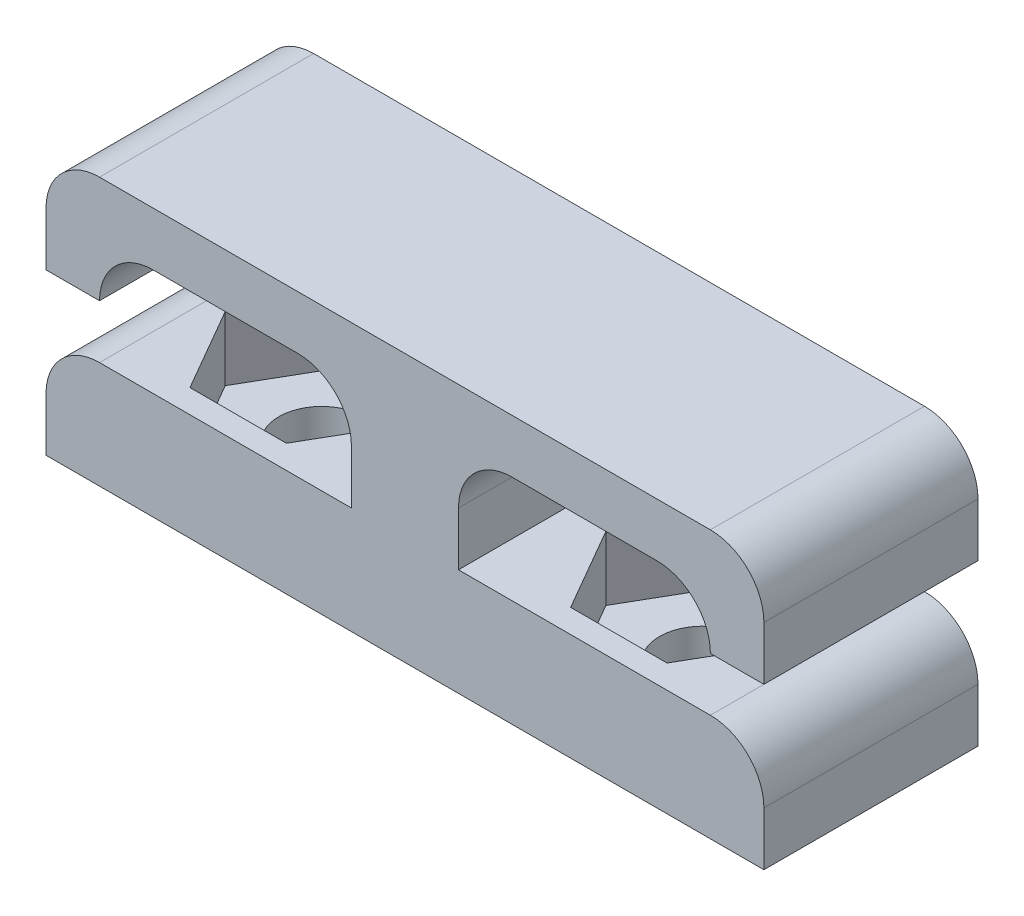
from build123d import *

# Parameters (mm, degrees)
SKETCH2_W           = 33.53
SKETCH2_H           = 10
SKETCH2_R           = 2
BOSS_EXTRUDE1_DEPTH = 5
CUT_EXTRUDE1_DEPTH  = 3
BOSS_EXTRUDE2_DEPTH = 10
FILLET1_START       = -11
FILLET1_DEPTH       = 12
FILLET1_START_2     = -10
FILLET1_2_DEPTH     = 10


with BuildPart() as part:
    # Sketch2 → Boss-Extrude1 (new body)
    with BuildSketch(Plane(origin=(0, 0, 0), x_dir=(1, 0, 0), z_dir=(0, 1, 0))):
        with Locations((16.765, 5)):
            Rectangle(SKETCH2_W, SKETCH2_H)
        with Locations(Location((7.875, 5, 0), (0, 0, 270))):
            Circle(SKETCH2_R, mode=Mode.SUBTRACT)
        with Locations(Location((25.655, 5, 0), (0, 0, 270))):
            Circle(SKETCH2_R, mode=Mode.SUBTRACT)
    extrude(amount=BOSS_EXTRUDE1_DEPTH)

    # Sketch3 → Cut-Extrude1 (cut)
    with BuildSketch(Plane(origin=(0, 5, 0), x_dir=(1, 0, 0), z_dir=(0, 1, 0))):
        Polygon((12.3783321, 5), (10.12666605, 8.9), (5.62333395, 8.9), (3.3716679, 5), (5.62333395, 1.1), (10.12666605, 1.1), align=None)
        Polygon((30.1583321, 5), (27.90666605, 8.9), (23.40333395, 8.9), (21.1516679, 5), (23.40333395, 1.1), (27.90666605, 1.1), align=None)
    extrude(amount=-CUT_EXTRUDE1_DEPTH, mode=Mode.SUBTRACT)

    # Sketch4 → Boss-Extrude2 (add)
    with BuildSketch(Plane(origin=(0, 0, -10), x_dir=(-1, 0, 0), z_dir=(0, 0, -1))):
        Polygon((-14.265, 5), (-14.265, 10), (-2.5, 10), (-2.5, 7.5), (0, 7.5), (0, 12.5), (-33.53, 12.5), (-33.53, 7.5), (-31.03, 7.5), (-31.03, 10), (-19.265, 10), (-19.265, 5), align=None)
    extrude(amount=-BOSS_EXTRUDE2_DEPTH)

    # Fillet1: read off the stored shape, not the designer's step
    # Fillet1 outline → Fillet1 (cut)
    with BuildSketch(Plane.XY.offset(FILLET1_START)):
        with BuildLine():
            Line((33.53, 12.5), (31.03, 12.5))
            ThreePointArc((31.03, 12.5), (32.797766953, 11.767766953), (33.53, 10))
            Line((33.53, 10), (33.53, 12.5))
        make_face()
        with BuildLine():
            ThreePointArc((0, 10), (0.732233047, 11.767766953), (2.5, 12.5))
            Line((2.5, 12.5), (0, 12.5))
            Line((0, 12.5), (0, 10))
        make_face()
        with BuildLine():
            Line((33.53, 5), (31.03, 5))
            ThreePointArc((31.03, 5), (32.797766953, 4.267766953), (33.53, 2.5))
            Line((33.53, 2.5), (33.53, 5))
        make_face()
        with BuildLine():
            ThreePointArc((0, 2.5), (0.732233047, 4.267766953), (2.5, 5))
            Line((2.5, 5), (0, 5))
            Line((0, 5), (0, 2.5))
        make_face()
    extrude(amount=FILLET1_DEPTH, mode=Mode.SUBTRACT)

    # Fillet1 2 outline → Fillet1 2 (add)
    with BuildSketch(Plane.XY.offset(FILLET1_START_2)):
        with BuildLine():
            Line((31.03, 10), (28.53, 10))
            ThreePointArc((28.53, 10), (30.297766953, 9.267766953), (31.03, 7.5))
            Line((31.03, 7.5), (31.03, 10))
        make_face()
        with BuildLine():
            Line((19.265, 10), (19.265, 7.5))
            ThreePointArc((19.265, 7.5), (19.997233047, 9.267766953), (21.765, 10))
            Line((21.765, 10), (19.265, 10))
        make_face()
        with BuildLine():
            ThreePointArc((2.5, 7.5), (3.232233047, 9.267766953), (5, 10))
            Line((5, 10), (2.5, 10))
            Line((2.5, 10), (2.5, 7.5))
        make_face()
        with BuildLine():
            ThreePointArc((11.765, 10), (13.532766953, 9.267766953), (14.265, 7.5))
            Line((14.265, 7.5), (14.265, 10))
            Line((14.265, 10), (11.765, 10))
        make_face()
    extrude(amount=FILLET1_2_DEPTH)


solid = part.part
